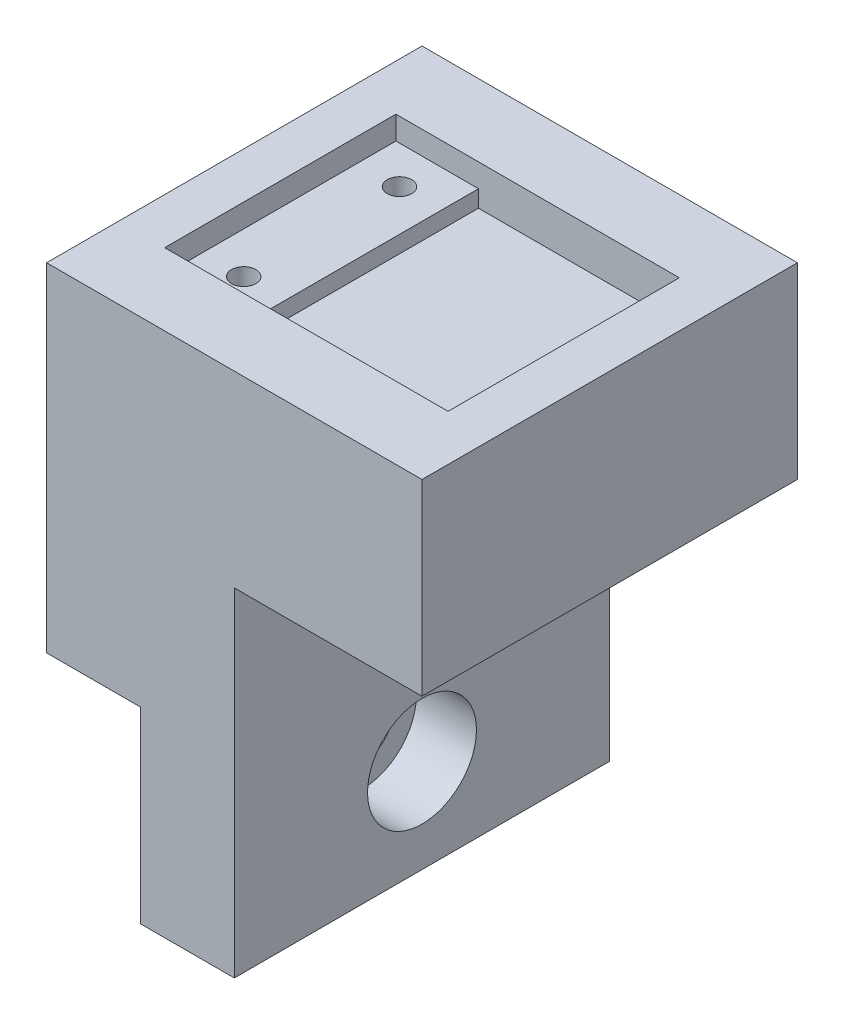
from build123d import *

# Parameters (mm, degrees)
BOSS_EXTRUDE1_DEPTH     = 12.7
CUT_EXTRUDE1_DEPTH      = 27.910817528
CUT_EXTRUDE1_DEPTH_BACK = 27.910817528
SCREWHOLE_R             = 2.159
CUT_EXTRUDE2_START      = -4.064
SKETCH3_R               = 3.683
SKETCH3_R_2             = 2.159
CUT_EXTRUDE2_DEPTH      = 4.064
SKETCH4_W               = 25.4
SKETCH4_H               = 12.7
BOSS_EXTRUDE2_DEPTH     = 12.7
SKETCH6_W               = 19.177
SKETCH6_H               = 15.6464
CUT_EXTRUDE3_DEPTH      = 1.5748
SKETCH9_W               = 13.589
SKETCH9_H               = 15.6464
CUT_EXTRUDE5_DEPTH      = 1.143
SKETCH7_R               = 0.8255
CUT_EXTRUDE6_DEPTH      = 12.7


with BuildPart() as part:
    # Profile → Boss-Extrude1 (new, symmetric)
    with BuildSketch(Plane.XY):
        Polygon((6.35, 22.86), (-6.35, 22.86), (-6.35, 0), (0, 0), (0, -12.7), (6.35, -12.7), align=None)
    extrude(amount=BOSS_EXTRUDE1_DEPTH, both=True)

    # ScrewHole → Cut-Extrude1 (cut, two sides: drawn at the far end of the back side and taken through both)
    with BuildSketch(Plane.ZY.offset(-CUT_EXTRUDE1_DEPTH_BACK)):
        with Locations((0, -6.35)):
            Circle(SCREWHOLE_R)
    extrude(amount=CUT_EXTRUDE1_DEPTH + CUT_EXTRUDE1_DEPTH_BACK, mode=Mode.SUBTRACT)

    # Sketch3 → Cut-Extrude2 (cut)
    with BuildSketch(Plane(origin=(6.35, 0, 0), x_dir=(0, 0, -1), z_dir=(1, 0, 0)).offset(CUT_EXTRUDE2_START)):
        with Locations((0, -6.35)):
            Circle(SKETCH3_R)
        with Locations((0, -6.35)):
            Circle(SKETCH3_R_2, mode=Mode.SUBTRACT)
    extrude(amount=CUT_EXTRUDE2_DEPTH, mode=Mode.SUBTRACT)

    # Sketch4 → Boss-Extrude2 (add)
    with BuildSketch(Plane(origin=(6.35, 0, 0), x_dir=(0, 0, -1), z_dir=(1, 0, 0))):
        with Locations((0, 16.51)):
            Rectangle(SKETCH4_W, SKETCH4_H)
    extrude(amount=BOSS_EXTRUDE2_DEPTH)

    # Sketch6 → Cut-Extrude3 (cut)
    with BuildSketch(Plane(origin=(0, 22.86, 0), x_dir=(1, 0, 0), z_dir=(0, 1, 0))):
        with Locations((6.35, 0)):
            Rectangle(SKETCH6_W, SKETCH6_H)
    extrude(amount=-CUT_EXTRUDE3_DEPTH, mode=Mode.SUBTRACT)

    # Sketch9 → Cut-Extrude5 (cut)
    with BuildSketch(Plane(origin=(0, 21.2852, 0), x_dir=(1, 0, 0), z_dir=(0, 1, 0))):
        with Locations((9.144, 0)):
            Rectangle(SKETCH9_W, SKETCH9_H)
    extrude(amount=-CUT_EXTRUDE5_DEPTH, mode=Mode.SUBTRACT)

    # Sketch7 → Cut-Extrude6 (cut)
    with BuildSketch(Plane(origin=(0, 21.2852, 0), x_dir=(1, 0, 0), z_dir=(0, 1, 0))):
        with Locations((-0.4445, -5.2705)):
            Circle(SKETCH7_R)
        with Locations((-0.4445, 5.2705)):
            Circle(SKETCH7_R)
    extrude(amount=-CUT_EXTRUDE6_DEPTH, mode=Mode.SUBTRACT)


solid = part.part
